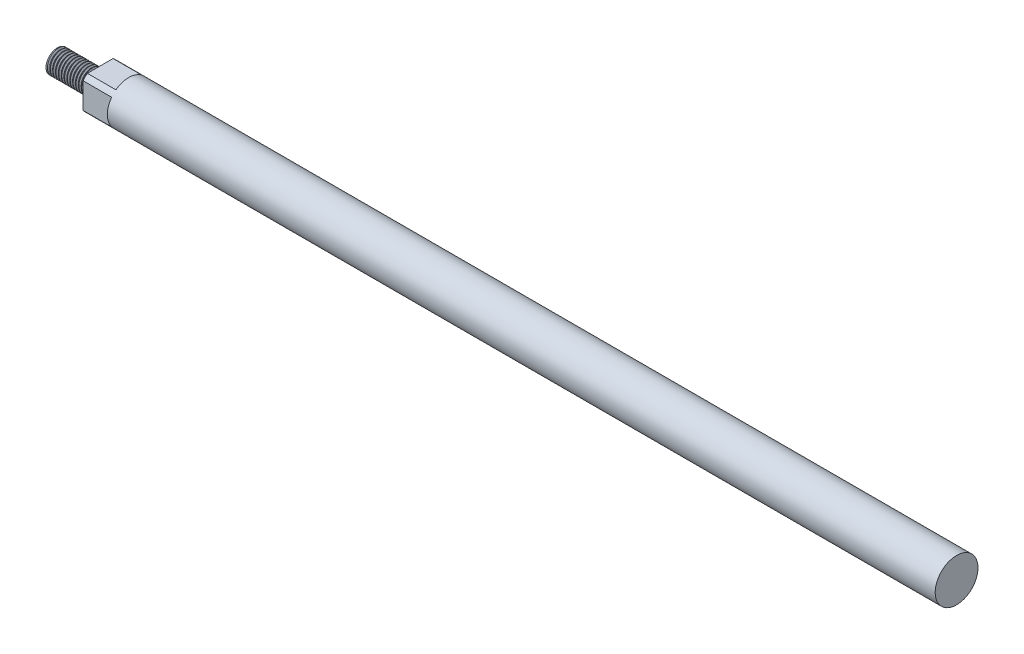
from build123d import *

# Parameters (mm, degrees)
SKETCH_1_R           = 15
EXTRUDE_1_DEPTH      = 300
SKETCH_2_R           = 8
EXTRUDE_2_DEPTH      = 30
THREAD_1_PITCH       = 2
SKETCH_3_OUTSIDE_W   = 158.286
SKETCH_3_OUTSIDE_H   = 158.286
SKETCH_3_OUTSIDE_W_2 = 24
SKETCH_3_OUTSIDE_H_2 = 24
CUT_EXTRUDE_1_DEPTH  = 20


with BuildPart() as part:
    # Sketch 1 → 凸台-拉伸1 (new, symmetric)
    with BuildSketch(Plane(origin=(0, 0, 0), x_dir=(0, 0, -1), z_dir=(1, 0, 0))):
        Circle(SKETCH_1_R)
    extrude(amount=EXTRUDE_1_DEPTH, both=True)

    # 草图2 → 凸台-拉伸2 (add)
    with BuildSketch(Plane.ZY.offset(300)):
        with Locations(Location((0, 0, 0), (0, 0, 180))):
            Circle(SKETCH_2_R)
    extrude(amount=EXTRUDE_2_DEPTH)

    # 螺纹线1: the profile of Sketch 1 2 profile screwed along a right-hand helix of 14 turns, 10 arcs to a turn; built about Z, then put on its axis
    thread_1_z = Axis((0, 0, 0), (0, 0, 1))
    thread_1_corners = [(8.0003, 0, -0.000173205), (8.0003, 0, 1.7501732), (6.91746825, 0, 1.124999997), (6.91746825, 0, 0.624999997)]
    with BuildLine(mode=Mode.PRIVATE) as thread_1_profile:
        Line(thread_1_corners[0], thread_1_corners[1])
        Line(thread_1_corners[1], thread_1_corners[2])
        Line(thread_1_corners[2], thread_1_corners[3])
        Line(thread_1_corners[3], thread_1_corners[0])
    thread_1_cap = Face(thread_1_profile.wire())
    thread_1_turn_angles = [0, 18, 36, 54, 72, 90, 108, 126, 144, 162, 180, 198, 216, 234, 252, 270, 288, 306, 324, 342, 360]
    thread_1_turn_weights = [1, 0.9510565162951535, 1, 0.9510565162951535, 1, 0.9510565162951535, 1, 0.9510565162951535, 1, 0.9510565162951535, 1, 0.9510565162951535, 1, 0.9510565162951535, 1, 0.9510565162951535, 1, 0.9510565162951535, 1, 0.9510565162951535, 1]
    thread_1_turn_rails = [Edge.make_bspline([Vector(p[0], p[1], 0).rotate(thread_1_z, thread_1_turn_angles[k]) / thread_1_turn_weights[k] + Vector(0, 0, p[2] + THREAD_1_PITCH * thread_1_turn_angles[k] / 360) for k in range(21)], [0, 0, 0, 1, 1, 2, 2, 3, 3, 4, 4, 5, 5, 6, 6, 7, 7, 8, 8, 9, 9, 10, 10, 10], 2, thread_1_turn_weights) for p in thread_1_corners]
    thread_1_turn_sides = [Face.make_surface_from_curves(thread_1_turn_rails[p[0]], thread_1_turn_rails[p[1]]) for p in [(0, 1), (1, 2), (2, 3), (3, 0)]]
    thread_1 = Plane(origin=(-330, 0, 0), x_dir=(0, 0, -1), z_dir=(1, 0, 0)) * Solid(Shell([*[p.moved(Location((0, 0, THREAD_1_PITCH * i))) for i in range(14) for p in thread_1_turn_sides], thread_1_cap, thread_1_cap.rotate(thread_1_z, 5040).moved(Location((0, 0, THREAD_1_PITCH * 5040 / 360)))]))
    add(thread_1, mode=Mode.SUBTRACT)

    # 草图3 outside → 切除-拉伸1 (cut)
    with BuildSketch(Plane.ZY.offset(300)):
        Rectangle(SKETCH_3_OUTSIDE_W, SKETCH_3_OUTSIDE_H)
        Rectangle(SKETCH_3_OUTSIDE_W_2, SKETCH_3_OUTSIDE_H_2, mode=Mode.SUBTRACT)
    extrude(amount=-CUT_EXTRUDE_1_DEPTH, mode=Mode.SUBTRACT)


solid = part.part
